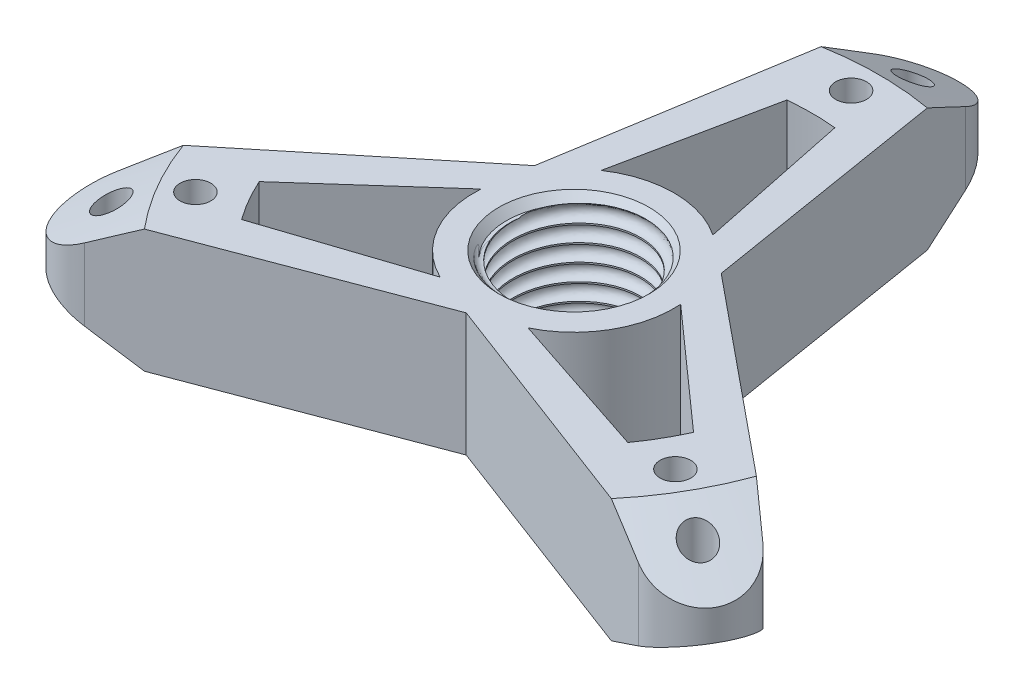
from build123d import *

# Parameters (mm, degrees)
SKETCH1_R               = 1
SKETCH1_R_2             = 4.15
BOSS_EXTRUDE1_DEPTH     = 4
CUT_SWEEP4_PITCH        = 1.1
SKETCH62_R              = 4.881214272
CUT_EXTRUDE4_DEPTH      = 0.5
CUT_EXTRUDE4_DRAFT      = -45
MIRROR6_COPY_1_SKETCH_R = 4.881214272
MIRROR6_COPY_1_DEPTH    = 0.5
MIRROR6_COPY_1_DRAFT    = -45
CUT_EXTRUDE8_DEPTH      = 16
CIRPATTERN1_COUNT       = 3
SKETCH76_R              = 4.881214272
SKETCH76_R_2            = 3
BOSS_EXTRUDE2_DEPTH     = 1


with BuildPart() as part:
    # Sketch1 → Boss-Extrude1 (new, symmetric)
    with BuildSketch(Plane(origin=(0, 0, 0), x_dir=(1, 0, 0), z_dir=(0, 1, 0))):
        with BuildLine():
            Line((-2.960747799, 22.483707009), (-6.062177826, 3.5))
            Line((-6.062177826, 3.5), (-20.95183534, -8.677770696))
            ThreePointArc((-20.95183534, -8.677770696), (-21.650635095, -12.5), (-17.991087541, -13.805936312))
            Line((-17.991087541, -13.805936312), (0, -7))
            Line((0, -7), (17.991087541, -13.805936312))
            ThreePointArc((17.991087541, -13.805936312), (21.650635095, -12.5), (20.95183534, -8.677770696))
            Line((20.95183534, -8.677770696), (6.062177826, 3.5))
            Line((6.062177826, 3.5), (2.960747799, 22.483707009))
            ThreePointArc((2.960747799, 22.483707009), (0, 25), (-2.960747799, 22.483707009))
        make_face()
        with Locations(Location((0, 22, 0), (0, 0, 270))):
            Circle(SKETCH1_R, mode=Mode.SUBTRACT)
        with Locations(Location((19.052558883, -11, 0), (0, 0, 270))):
            Circle(SKETCH1_R, mode=Mode.SUBTRACT)
        with Locations(Location((-19.052558883, -11, 0), (0, 0, 270))):
            Circle(SKETCH1_R, mode=Mode.SUBTRACT)
        with Locations(Location((0, 0, 0), (0, 0, 270))):
            Circle(SKETCH1_R_2, mode=Mode.SUBTRACT)
        with Locations(Location((0, 18, 0), (0, 0, 270))):
            Circle(SKETCH1_R, mode=Mode.SUBTRACT)
        with Locations(Location((15.588457268, -9, 0), (0, 0, 270))):
            Circle(SKETCH1_R, mode=Mode.SUBTRACT)
        with Locations(Location((-15.588457268, -9, 0), (0, 0, 270))):
            Circle(SKETCH1_R, mode=Mode.SUBTRACT)
    extrude(amount=BOSS_EXTRUDE1_DEPTH, both=True)

    # Cut-Sweep4: the profile of Cut-Sweep4 profile screwed along a left-hand helix of 15 turns, 8 arcs to a turn; built about Z, then put on its axis
    cut_sweep4_z = Axis((0, 0, 0), (0, 0, 1))
    cut_sweep4_corners = [(4.15, -0.02107408, -0.499555686), (4.65, 0, 0), (4.15, 0.02107408, 0.499555686), (3.65, 0, 0)]
    with BuildLine(mode=Mode.PRIVATE) as cut_sweep4_profile:
        ThreePointArc((4.15, -0.02107408, -0.499555686), (4.503553391, -0.014901625, -0.353239213), (4.65, 0, 0))
        ThreePointArc((4.65, 0, 0), (4.503553391, 0.014901625, 0.353239213), (4.15, 0.02107408, 0.499555686))
        ThreePointArc((4.15, 0.02107408, 0.499555686), (3.796446609, 0.014901625, 0.353239213), (3.65, 0, 0))
        ThreePointArc((3.65, 0, 0), (3.796446609, -0.014901625, -0.353239213), (4.15, -0.02107408, -0.499555686))
    cut_sweep4_cap = Face(cut_sweep4_profile.wire())
    cut_sweep4_arcs = [((4.15, -0.02107408, -0.499555686), (4.65, -0.02107408, -0.499555686), (4.65, 0, 0), (1, 0.7071067811865476, 1)), ((4.65, 0, 0), (4.65, 0.02107408, 0.499555686), (4.15, 0.02107408, 0.499555686), (1, 0.7071067811865476, 1)), ((4.15, 0.02107408, 0.499555686), (3.65, 0.02107408, 0.499555686), (3.65, 0, 0), (1, 0.7071067811865476, 1)), ((3.65, 0, 0), (3.65, -0.02107408, -0.499555686), (4.15, -0.02107408, -0.499555686), (1, 0.7071067811865476, 1))]  # start, shoulder, end, weights
    cut_sweep4_turn_angles = [0, -22.5, -45, -67.5, -90, -112.5, -135, -157.5, -180, -202.5, -225, -247.5, -270, -292.5, -315, -337.5, -360]
    cut_sweep4_turn_weights = [1, 0.9238795325112867, 1, 0.9238795325112867, 1, 0.9238795325112867, 1, 0.9238795325112867, 1, 0.9238795325112867, 1, 0.9238795325112867, 1, 0.9238795325112867, 1, 0.9238795325112867, 1]
    cut_sweep4_turn_sides = [Face.make_bezier_surface([[Vector(p[j][0], p[j][1], 0).rotate(cut_sweep4_z, cut_sweep4_turn_angles[2 * i + k]) / cut_sweep4_turn_weights[2 * i + k] + Vector(0, 0, p[j][2] + -CUT_SWEEP4_PITCH * cut_sweep4_turn_angles[2 * i + k] / 360) for k in range(3)] for j in range(3)], [[p[3][j] * cut_sweep4_turn_weights[2 * i + k] for k in range(3)] for j in range(3)]) for p in cut_sweep4_arcs for i in range(8)]
    cut_sweep4 = Plane(origin=(0, -5, 0), x_dir=(0, 0, 1), z_dir=(0, 1, 0)) * Solid(Shell([*[p.moved(Location((0, 0, CUT_SWEEP4_PITCH * i))) for i in range(15) for p in cut_sweep4_turn_sides], cut_sweep4_cap, cut_sweep4_cap.rotate(cut_sweep4_z, -5400).moved(Location((0, 0, -CUT_SWEEP4_PITCH * -5400 / 360)))]))
    add(cut_sweep4, mode=Mode.SUBTRACT)


with BuildPart() as cut_extrude4_tool:
    # Sketch62 → Cut-Extrude4 (with draft: the straight prism first)
    with BuildSketch(Plane(origin=(0, 4, 0), x_dir=(1, 0, 0), z_dir=(0, 1, 0))):
        Circle(SKETCH62_R)
    extrude(amount=-CUT_EXTRUDE4_DEPTH)
    # Cut-Extrude4: the draft: its side faces are tilted about the plane it starts from
    cut_extrude4_sides = [cut_extrude4_tool.faces().sort_by_distance(p)[0] for p in [
        (-4.881214272, 3.75, 0),
    ]]
    draft(cut_extrude4_sides, Plane(origin=(0, 4, 0), x_dir=(1, 0, 0), z_dir=(0, 1, 0)), CUT_EXTRUDE4_DRAFT)


with BuildPart() as part_1:
    add(part.part)

    # Cut-Extrude4: cut by cut_extrude4_tool
    add(cut_extrude4_tool.part, mode=Mode.SUBTRACT)


with BuildPart() as mirror6_copy_1_tool:
    # Mirror6 copy 1 sketch → Mirror6 copy 1 (with draft: the straight prism first)
    with BuildSketch(Plane.XZ.offset(4)):
        Circle(MIRROR6_COPY_1_SKETCH_R)
    extrude(amount=-MIRROR6_COPY_1_DEPTH)
    # Mirror6 copy 1: the draft: its side faces are tilted about the plane it starts from
    mirror6_copy_1_sides = [mirror6_copy_1_tool.faces().sort_by_distance(p)[0] for p in [
        (-4.881214272, -3.75, 0),
    ]]
    draft(mirror6_copy_1_sides, Plane.XZ.offset(4), MIRROR6_COPY_1_DRAFT)


with BuildPart() as part_2:
    add(part_1.part)

    # Mirror6 copy 1: cut by mirror6_copy_1_tool
    add(mirror6_copy_1_tool.part, mode=Mode.SUBTRACT)

    # Sketch74 → Cut-Revolve1 (revolve, cut)
    with BuildSketch(Plane(origin=(0, 0, 0), x_dir=(0, 0, -1), z_dir=(1, 0, 0)), mode=Mode.PRIVATE) as cut_revolve1_sk:
        Polygon((25, 1), (19.803847577, 4), (25, 4), align=None)
    cut_revolve1 = revolve(cut_revolve1_sk.sketch.rotate(Axis((0, 0, 0), (0, -1, 0)), 180), axis=Axis((0, 0, 0), (0, -1, 0)), mode=Mode.SUBTRACT)

    # Mirror8: Cut-Revolve1 across plane
    add(cut_revolve1.mirror(Plane.ZX), mode=Mode.SUBTRACT)

    # Sketch75 → Cut-Extrude8 (cut)
    with BuildSketch(Plane(origin=(0, 4, 0), x_dir=(1, 0, 0), z_dir=(0, 1, 0))):
        with BuildLine():
            Line((1.561855942, 15.385502775), (3.628361218, 5.393050609))
            ThreePointArc((3.628361218, 5.393050609), (0, 6.5), (-3.628361218, 5.393050609))
            Line((-3.628361218, 5.393050609), (-1.561855942, 15.385502775))
            ThreePointArc((-1.561855942, 15.385502775), (0, 15.464575314), (1.561855942, 15.385502775))
        make_face()
    cut_extrude8 = extrude(amount=-CUT_EXTRUDE8_DEPTH, mode=Mode.SUBTRACT)

    # CirPattern1: Cut-Extrude8 ×3 about axis
    cirpattern1_axis = Axis((0, 0, 0), (0, 1, 0))
    for i in range(1, CIRPATTERN1_COUNT):
        add(cut_extrude8.rotate(cirpattern1_axis, i * 360 / CIRPATTERN1_COUNT), mode=Mode.SUBTRACT)

    # Sketch76 → Boss-Extrude2 (add)
    with BuildSketch(Plane.XZ.offset(4)):
        Circle(SKETCH76_R)
        with Locations(Location((0, 0, 0), (0, 0, 270))):
            Circle(SKETCH76_R_2, mode=Mode.SUBTRACT)
    extrude(amount=-BOSS_EXTRUDE2_DEPTH)


solid = part_2.part
